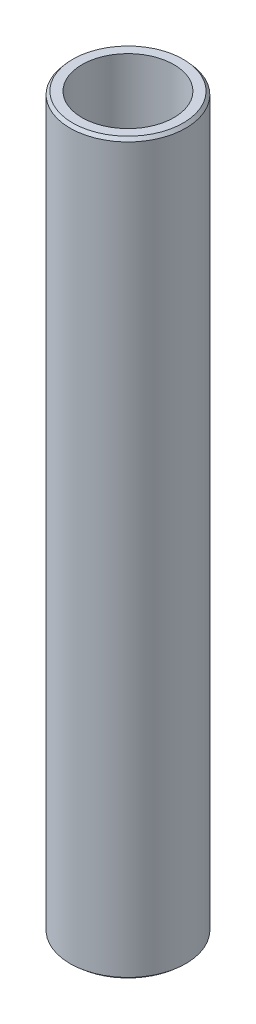
from build123d import *
from OCP.BRepFilletAPI import BRepFilletAPI_MakeChamfer

# Parameters (mm, degrees)
SKETCH1_R           = 40
BOSS_EXTRUDE1_DEPTH = 503.659228782
SKETCH2_R           = 31.738929851
CUT_EXTRUDE1_DEPTH  = 507.826024132
CHAMFER1_SIZE       = 2.143635996
CHAMFER1_SIZE2      = 1.843665085


with BuildPart() as part:
    # Sketch1 → Boss-Extrude1 (new body)
    with BuildSketch(Plane(origin=(0, 0, 0), x_dir=(1, 0, 0), z_dir=(0, 1, 0))):
        Circle(SKETCH1_R)
    extrude(amount=BOSS_EXTRUDE1_DEPTH)

    # Sketch2 → Cut-Extrude1 (cut, through all)
    with BuildSketch(Plane(origin=(0, 0, 0), x_dir=(1, 0, 0), z_dir=(0, 1, 0))):
        Circle(SKETCH2_R)
    extrude(amount=CUT_EXTRUDE1_DEPTH, mode=Mode.SUBTRACT)

    # Chamfer1: one chamfer whose edges measure the first distance from different faces: ONE call of the kernel's chamfer builder (chamfer() names one face for all edges)
    chamfer1_edges_1 = [part.edges().sort_by_distance(p)[0] for p in [
        (-40, 503.659228782, 0),
    ]]
    chamfer1_side_1 = [part.faces().sort_by_distance(p)[0] for p in [
        (-40, 251.829614391, 0),
    ]]
    chamfer1_edges_2 = [part.edges().sort_by_distance(p)[0] for p in [
        (-40, 0, 0),
    ]]
    chamfer1_side_2 = [part.faces().sort_by_distance(p)[0] for p in [
        (-38.86862915, 0, 0),
    ]]
    chamfer1 = BRepFilletAPI_MakeChamfer(part.part.solid().wrapped)
    for e in chamfer1_edges_1:
        chamfer1.Add(CHAMFER1_SIZE, CHAMFER1_SIZE2, e.wrapped, chamfer1_side_1[0].wrapped)  # the first distance lies on this face
    for e in chamfer1_edges_2:
        chamfer1.Add(CHAMFER1_SIZE, CHAMFER1_SIZE2, e.wrapped, chamfer1_side_2[0].wrapped)  # the first distance lies on this face
    add(Compound.cast(chamfer1.Shape()), mode=Mode.REPLACE)


solid = part.part
